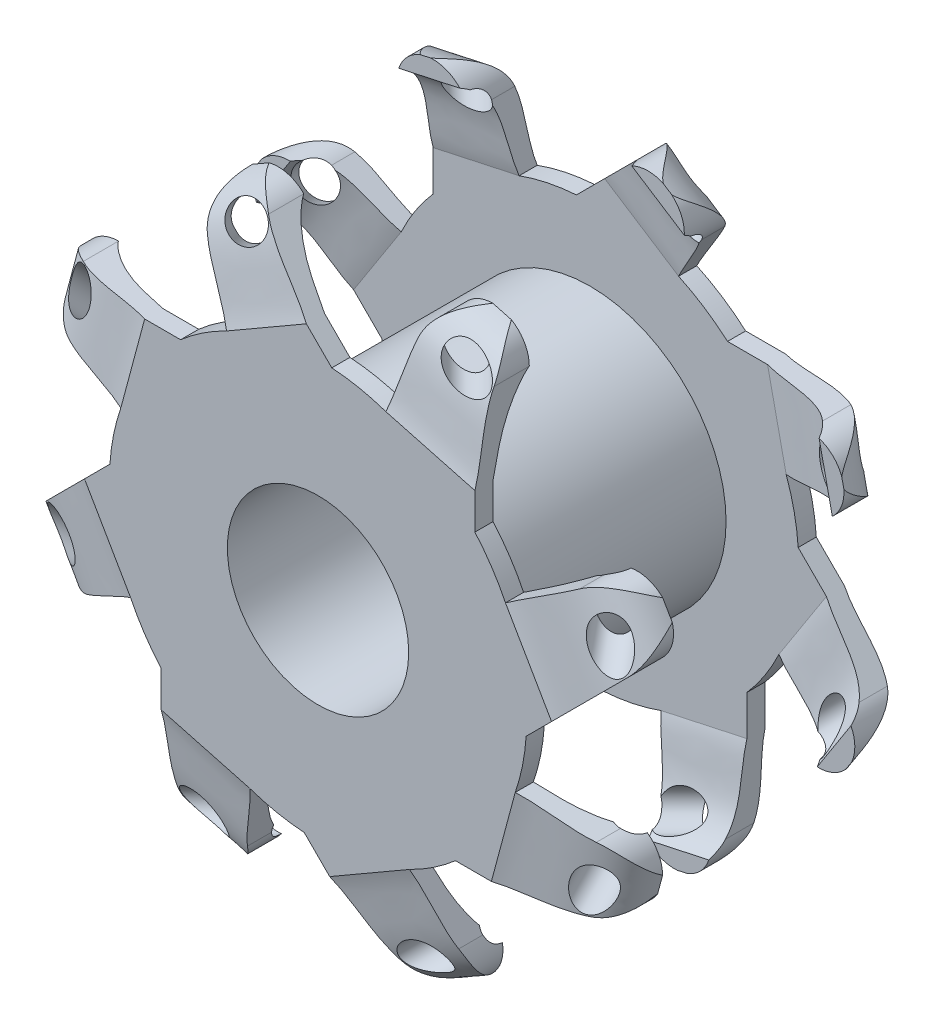
from build123d import *

# Parameters (mm, degrees)
SKETCH1_R               = 15
SS_EXTRUDE1_DEPTH       = 30
SKETCH2_R               = 23
BOSS_EXTRUDE2_DEPTH     = 2
SKETCH3_R               = 23
BOSS_EXTRUDE3_DEPTH     = 2
BOSS_EXTRUDE4_START     = -6
BOSS_EXTRUDE4_DEPTH     = 6
BOSS_EXTRUDE5_DEPTH     = 6
SKETCH8_R               = 2
CUT_EXTRUDE1_DEPTH      = 50.527770417
CUT_EXTRUDE4_DEPTH      = 15
CUT_EXTRUDE5_DEPTH      = 15
CIRPATTERN6_COUNT       = 8
CIRPATTERN7_COUNT       = 8
CUT_EXTRUDE6_DEPTH      = 56.723147622
CUT_EXTRUDE6_DEPTH_BACK = 56.723147622
SKETCH11_R              = 10


with BuildPart() as part:
    # Sketch1 → ss-Extrude1 (new body)
    with BuildSketch(Plane.XY):
        Circle(SKETCH1_R)
    ss_extrude1 = extrude(amount=-SS_EXTRUDE1_DEPTH)

    # Sketch2 → Boss-Extrude2 (add)
    with BuildSketch(Plane.XY):
        Circle(SKETCH2_R)
    boss_extrude2 = extrude(amount=BOSS_EXTRUDE2_DEPTH)

    # Sketch3 → Boss-Extrude3 (add)
    with BuildSketch(Plane(origin=(0, 0, -30), x_dir=(-1, 0, 0), z_dir=(0, 0, -1))):
        with Locations(Location((0, 0, 0), (0, 0, 180))):
            Circle(SKETCH3_R)
    extrude(amount=-BOSS_EXTRUDE3_DEPTH)

    # Sketch5 → Boss-Extrude4 (add)
    with BuildSketch(Plane.XY.offset(2).offset(BOSS_EXTRUDE4_START)):
        with BuildLine():
            Line((15.154691773, -17.301309698), (28, -17.301309698))
            ThreePointArc((28, -17.301309698), (31.965827804, -13.823047014), (29.034560176, -9.437414611))
            Line((29.034560176, -9.437414611), (21.747532764, -7.486308748))
            ThreePointArc((21.747532764, -7.486308748), (19.092592932, -12.824698638), (15.154691773, -17.301309698))
        make_face()
    boss_extrude4 = extrude(amount=BOSS_EXTRUDE4_DEPTH)

    # Sketch6 → Boss-Extrude5 (add)
    with BuildSketch(Plane(origin=(0, 0, -30), x_dir=(-1, 0, 0), z_dir=(0, 0, -1))):
        with BuildLine():
            Line((-15.160590445, 17.296141112), (-28, 17.296141112))
            ThreePointArc((-28, 17.296141112), (-31.977210392, 13.722518293), (-28.847895877, 9.387039862))
            Line((-28.847895877, 9.387039862), (-21.629312345, 7.821307274))
            ThreePointArc((-21.629312345, 7.821307274), (-18.995192968, 12.968525133), (-15.160590445, 17.296141112))
        make_face()
    boss_extrude5 = extrude(amount=-BOSS_EXTRUDE5_DEPTH)

    # Sketch8 → Cut-Extrude1 (cut, symmetric)
    with BuildSketch(Plane(origin=(-1.18e-06, 6.99999764, -6.99999764), x_dir=(0, 0.7071067811865439, 0.7071067811865512), z_dir=(-1.192092896120129e-07, 0.7071067811865462, -0.7071067811865389))):
        with Locations(Location((-10.186742756, 28.331250457, 0), (0, 0, 350.46655598))):
            Circle(SKETCH8_R)
    cut_extrude1 = extrude(amount=CUT_EXTRUDE1_DEPTH, both=True, mode=Mode.SUBTRACT)

    # Sketch10 → Cut-Extrude4 (cut)
    with BuildSketch(Plane(origin=(-0.648368875, 2.989210877, 0), x_dir=(0.9772753124431974, 0.21197396936664378, 0), z_dir=(0.21197396936664378, -0.9772753124431975, 0))):
        with BuildLine():
            add(Edge.make_bspline(
                [(29.687736426, -26.51649887), (30.951551899, -25.932842362), (31.9870619, -24.948203927), (32.548537045, -23.138080541)],
                knots=[0.618217564, 0.618217564, 0.618217564, 0.618217564, 1, 1, 1, 1], degree=3))
            Line((32.548537045, -23.138080541), (18.65828282, -21.431742028))
            Line((18.65828282, -21.431742028), (17.229503571, -28))
            Line((17.229503571, -28), (22.795706529, -28))
            Line((22.795706529, -28), (22.795706529, -24))
            Line((22.795706529, -24), (27.67778753, -24))
            add(Edge.make_bspline(
                [(27.67778753, -24), (28.093568101, -26.21545958), (29.687736426, -26.51649887)],
                knots=[4.678580772, 4.678580772, 4.678580772, 5.987140113, 5.987140113, 5.987140113], degree=2, weights=[1, 0.75635755, 0.919307532]))
        make_face()
        with BuildLine():
            add(Edge.make_bspline(
                [(22.795706529, -28), (24.996119838, -27.355302034), (27.641249081, -27.461609672), (29.687736426, -26.51649887)],
                knots=[0, 0, 0, 0, 0.618217564, 0.618217564, 0.618217564, 0.618217564], degree=3))
            add(Edge.make_bspline(
                [(27.67778753, -24), (28.093568101, -26.21545958), (29.687736426, -26.51649887)],
                knots=[4.678580772, 4.678580772, 4.678580772, 5.987140113, 5.987140113, 5.987140113], degree=2, weights=[1, 0.75635755, 0.919307532]))
            Line((27.67778753, -24), (22.795706529, -24))
            Line((22.795706529, -24), (22.795706529, -28))
        make_face()
        with BuildLine():
            Line((30.182144557, -30), (30.182144557, -29.090655753))
            add(Edge.make_bspline(
                [(22.795706529, -30), (24.942526902, -29.407717363), (27.910746032, -29.793059948), (30.182144557, -29.090655753)],
                knots=[0, 0, 0, 0, 0.362211893, 0.362211893, 0.362211893, 0.362211893], degree=3))
            Line((22.795706529, -30), (30.182144557, -30))
        make_face()
        with BuildLine():
            add(Edge.make_bspline(
                [(30.182144557, -29.090655753), (30.704087287, -28.929250892), (34.421654826, -27.252327179), (34.897089836, -20.731395195), (34.306434782, -17.906164416)],
                knots=[0.362211893, 0.362211893, 0.362211893, 0.362211893, 0.445444255, 1, 1, 1, 1], degree=3))
            Line((30.182144557, -29.090655753), (30.182144557, -30))
            Line((30.182144557, -30), (22.795706529, -30))
            Line((22.795706529, -30), (17.943893195, -31.941513247))
            Line((17.943893195, -31.941513247), (39.342314041, -33.384330833))
            Line((39.342314041, -33.384330833), (34.306434782, -17.906164416))
        make_face()
    cut_extrude4 = extrude(amount=-CUT_EXTRUDE4_DEPTH, mode=Mode.SUBTRACT)

    # Sketch9 → Cut-Extrude5 (cut)
    with BuildSketch(Plane(origin=(-0.415581547, -1.552121891, 0), x_dir=(0.9659737717226313, -0.25864004396835755, 0), z_dir=(0.2586400439683575, 0.9659737717226312, 0))):
        with BuildLine():
            Line((22.943805474, 4), (22.943805474, 0))
            add(Edge.make_bspline(
                [(22.943805474, 0), (25.095603016, 0.473390819), (27.33894008, 0.923338275), (29.492505686, 2.230659051), (29.678710062, 2.351728443)],
                knots=[0, 0, 0, 0, 0.412137313, 0.451949852, 0.451949852, 0.451949852, 0.451949852], degree=3))
            add(Edge.make_bspline(
                [(28.051525149, 4), (28.639448549, 2.675918332), (29.678710062, 2.351728443)],
                knots=[1.809599306, 1.809599306, 1.809599306, 2.732269736, 2.732269736, 2.732269736], degree=2, weights=[1, 0.852242244, 0.909593483]))
            Line((28.051525149, 4), (22.943805474, 4))
        make_face()
        with BuildLine():
            Line((16.436354412, 0), (22.943805474, 0))
            Line((22.943805474, 0), (22.943805474, 4))
            Line((22.943805474, 4), (28.051525149, 4))
            add(Edge.make_bspline(
                [(28.051525149, 4), (28.639448549, 2.675918332), (29.678710062, 2.351728443)],
                knots=[1.809599306, 1.809599306, 1.809599306, 2.732269736, 2.732269736, 2.732269736], degree=2, weights=[1, 0.852242244, 0.909593483]))
            add(Edge.make_bspline(
                [(29.678710062, 2.351728443), (32.241956104, 4.018341483), (34.141104489, 6.804253018), (28.051525149, 8.762231078)],
                knots=[0.451949852, 0.451949852, 0.451949852, 0.451949852, 1, 1, 1, 1], degree=3))
            Line((28.051525149, 8.762231078), (16.436354412, 6.621068085))
            Line((16.436354412, 6.621068085), (16.436354412, 0))
        make_face()
        with BuildLine():
            add(Edge.make_bspline(
                [(30.487516933, -0.344378274), (32.468941046, 0.375096936), (34.029601794, 1.643169567), (34.391975221, 4.302512453)],
                knots=[0.543111159, 0.543111159, 0.543111159, 0.543111159, 1, 1, 1, 1], degree=3))
            Line((30.487516933, -0.344378274), (30.487516933, -2))
            Line((30.487516933, -2), (22.943805474, -2))
            Line((22.943805474, -2), (19.122740988, -3.480079447))
            Line((19.122740988, -3.480079447), (38.157525495, -7.647167073))
            Line((38.157525495, -7.647167073), (40.071880454, 2.350225744))
            Line((40.071880454, 2.350225744), (35.070824823, 7.847688917))
            Line((35.070824823, 7.847688917), (34.391975221, 4.302512453))
        make_face()
        with BuildLine():
            Line((30.487516933, -2), (30.487516933, -0.344378274))
            add(Edge.make_bspline(
                [(22.943805474, -2), (25.182257071, -1.279688443), (28.13216603, -1.199630098), (30.487516933, -0.344378274)],
                knots=[0, 0, 0, 0, 0.543111159, 0.543111159, 0.543111159, 0.543111159], degree=3))
            Line((22.943805474, -2), (30.487516933, -2))
        make_face()
    cut_extrude5 = extrude(amount=-CUT_EXTRUDE5_DEPTH, mode=Mode.SUBTRACT)

    # CirPattern6: Boss-Extrude2, Boss-Extrude4, Cut-Extrude1, Cut-Extrude5 ×8 about axis
    cirpattern6_axis = Axis((0, 0, 0), (0, 0, -1))
    add([boss_extrude2.rotate(cirpattern6_axis, i * 360 / CIRPATTERN6_COUNT) for i in range(1, CIRPATTERN6_COUNT)])
    add([boss_extrude4.rotate(cirpattern6_axis, i * 360 / CIRPATTERN6_COUNT) for i in range(1, CIRPATTERN6_COUNT)])
    add([cut_extrude1.rotate(cirpattern6_axis, i * 360 / CIRPATTERN6_COUNT) for i in range(1, CIRPATTERN6_COUNT)], mode=Mode.SUBTRACT)
    add([cut_extrude5.rotate(cirpattern6_axis, i * 360 / CIRPATTERN6_COUNT) for i in range(1, CIRPATTERN6_COUNT)], mode=Mode.SUBTRACT)

    # CirPattern7: ss-Extrude1, Boss-Extrude5, Cut-Extrude1, Cut-Extrude4 ×8 about axis
    cirpattern7_axis = Axis((0, 0, -30), (0, 0, -1))
    add([ss_extrude1.rotate(cirpattern7_axis, i * 360 / CIRPATTERN7_COUNT) for i in range(1, CIRPATTERN7_COUNT)])
    add([boss_extrude5.rotate(cirpattern7_axis, i * 360 / CIRPATTERN7_COUNT) for i in range(1, CIRPATTERN7_COUNT)])
    add([cut_extrude1.rotate(cirpattern7_axis, i * 360 / CIRPATTERN7_COUNT) for i in range(1, CIRPATTERN7_COUNT)], mode=Mode.SUBTRACT)
    add([cut_extrude4.rotate(cirpattern7_axis, i * 360 / CIRPATTERN7_COUNT) for i in range(1, CIRPATTERN7_COUNT)], mode=Mode.SUBTRACT)

    # Sketch11 → Cut-Extrude6 (cut, two sides: drawn at the far end of the back side and taken through both)
    with BuildSketch(Plane.XY.offset(-CUT_EXTRUDE6_DEPTH_BACK)):
        Circle(SKETCH11_R)
    extrude(amount=CUT_EXTRUDE6_DEPTH + CUT_EXTRUDE6_DEPTH_BACK, mode=Mode.SUBTRACT)


solid = part.part
